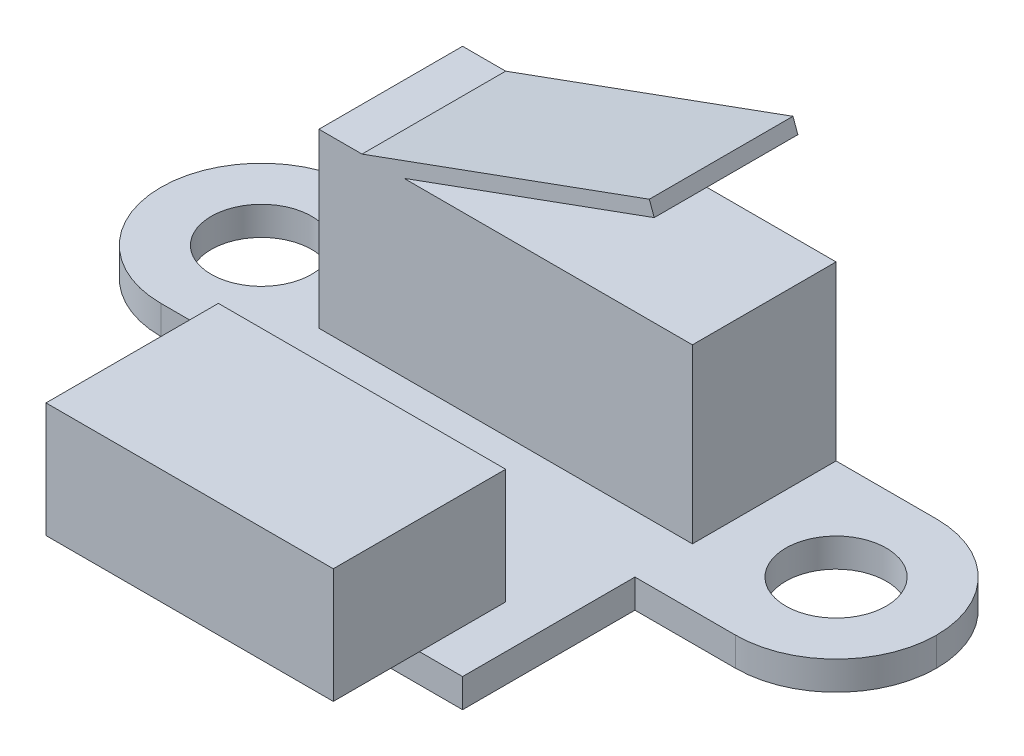
from build123d import *

# Parameters (mm, degrees)
SKETCH1_W           = 13
SKETCH1_H           = 13
BOSS_EXTRUDE1_DEPTH = 1
SKETCH4_W           = 7
SKETCH4_H           = 1
BOSS_EXTRUDE2_DEPTH = 7
SKETCH5_W           = 7
SKETCH5_H           = 1
BOSS_EXTRUDE3_DEPTH = 7
SKETCH6_R           = 1.75
CUT_EXTRUDE1_DEPTH  = 16.016657418
SKETCH7_W           = 10
SKETCH7_H           = 6
BOSS_EXTRUDE4_DEPTH = 4
SKETCH8_W           = 13
SKETCH8_H           = 5
BOSS_EXTRUDE5_DEPTH = 6
BOSS_EXTRUDE6_DEPTH = 5
FILLET1_R           = 3.5


with BuildPart() as part:
    # Sketch1 → Boss-Extrude1 (new body)
    with BuildSketch(Plane(origin=(0, 0, 0), x_dir=(1, 0, 0), z_dir=(0, 1, 0))):
        Rectangle(SKETCH1_W, SKETCH1_H)
    extrude(amount=BOSS_EXTRUDE1_DEPTH)

    # Sketch4 → Boss-Extrude2 (add)
    with BuildSketch(Plane.ZY.offset(6.5)):
        with Locations((-3, 0.5)):
            Rectangle(SKETCH4_W, SKETCH4_H)
    extrude(amount=BOSS_EXTRUDE2_DEPTH)

    # Sketch5 → Boss-Extrude3 (add)
    with BuildSketch(Plane(origin=(6.5, 0, 0), x_dir=(0, 0, -1), z_dir=(1, 0, 0))):
        with Locations((3, 0.5)):
            Rectangle(SKETCH5_W, SKETCH5_H)
    extrude(amount=BOSS_EXTRUDE3_DEPTH)

    # Sketch6 → Cut-Extrude1 (cut, through all)
    with BuildSketch(Plane(origin=(0, 1, 0), x_dir=(1, 0, 0), z_dir=(0, 1, 0))):
        with Locations(Location((-10, 3, 0), (0, 0, 270))):
            Circle(SKETCH6_R)
        with Locations(Location((10, 3, 0), (0, 0, 270))):
            Circle(SKETCH6_R)
    extrude(amount=-CUT_EXTRUDE1_DEPTH, mode=Mode.SUBTRACT)

    # Sketch7 → Boss-Extrude4 (add)
    with BuildSketch(Plane(origin=(0, 1, 0), x_dir=(1, 0, 0), z_dir=(0, 1, 0))):
        with Locations((0, -6.5)):
            Rectangle(SKETCH7_W, SKETCH7_H)
    extrude(amount=BOSS_EXTRUDE4_DEPTH)

    # Sketch8 → Boss-Extrude5 (add)
    with BuildSketch(Plane(origin=(0, 1, 0), x_dir=(1, 0, 0), z_dir=(0, 1, 0))):
        with Locations((0, 4)):
            Rectangle(SKETCH8_W, SKETCH8_H)
    extrude(amount=BOSS_EXTRUDE5_DEPTH)

    # Sketch9 → Boss-Extrude6 (add)
    with BuildSketch(Plane.XY.offset(-1.5)):
        Polygon((-5, 7), (5, 10.639702343), (5.171010072, 10.169856032), (-3.5380978, 7), align=None)
    extrude(amount=-BOSS_EXTRUDE6_DEPTH)

    # Fillet1
    fillet1_edges = [part.edges().sort_by_distance(p)[0] for p in [
        (13.5, 0.5, -6.5),
        (13.5, 0.5, 0.5),
        (-13.5, 0.5, -6.5),
        (-13.5, 0.5, 0.5),
    ]]
    fillet(fillet1_edges, radius=FILLET1_R - 0.0001)  # a hair under: the kernel refuses the full size


solid = part.part
